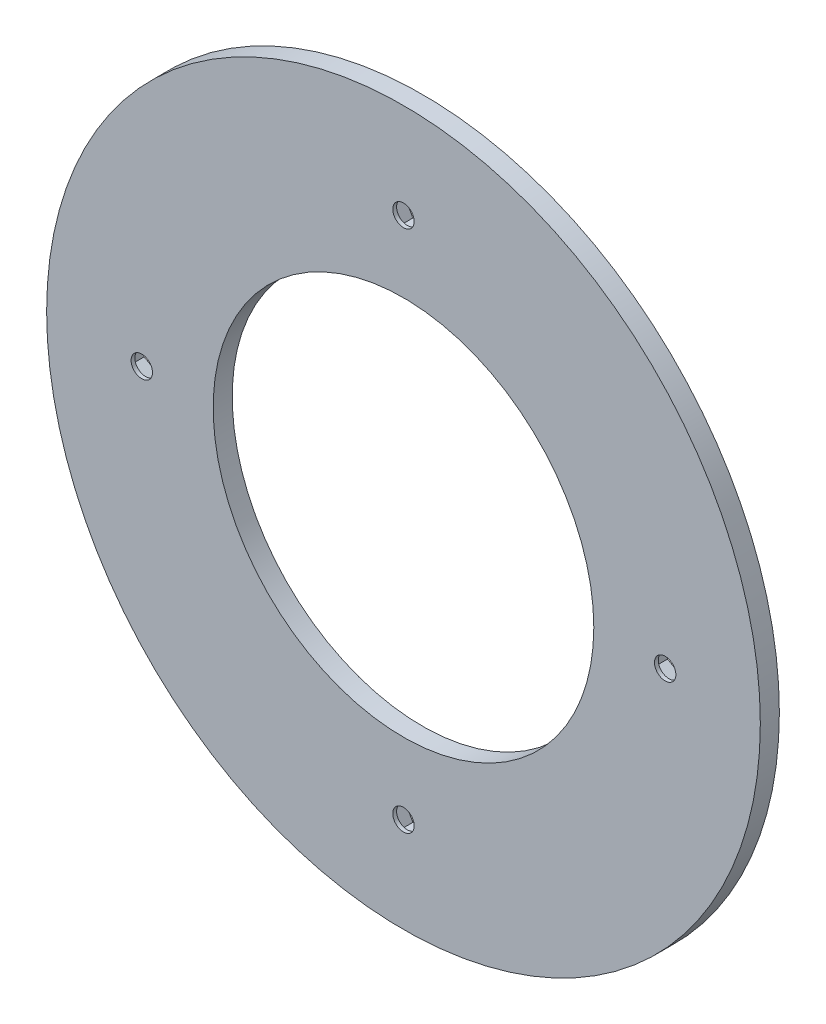
from build123d import *

# Parameters (mm, degrees)
SKETCH1_R            = 75
SKETCH1_R_2          = 40
BOSS_EXTRUDE1_DEPTH  = 4
M4_CLEARANCE_HOLE1_D = 4.5
CUT_EXTRUDE2_DEPTH   = 3.2


with BuildPart() as part:
    # Sketch1 → Boss-Extrude1 (new body)
    with BuildSketch(Plane.XY):
        Circle(SKETCH1_R)
        Circle(SKETCH1_R_2, mode=Mode.SUBTRACT)
    extrude(amount=BOSS_EXTRUDE1_DEPTH)

    # M4 Clearance Hole1 (through all)
    with Locations(Plane(origin=(0, 0, 0), x_dir=(-1, 0, 0), z_dir=(0, 0, -1))):
        with Locations((0, 55), (55, 0), (0, -55), (-55, 0)):
            Hole(M4_CLEARANCE_HOLE1_D / 2)

    # Sketch13 → Cut-Extrude2 (cut)
    with BuildSketch(Plane(origin=(0, 0, 0), x_dir=(-1, 0, 0), z_dir=(0, 0, -1))):
        Polygon((4.041451884, 55), (2.020725942, 58.5), (-2.020725942, 58.5), (-4.041451884, 55), (-2.020725942, 51.5), (2.020725942, 51.5), align=None)
        Polygon((55, -4.041451884), (58.5, -2.020725942), (58.5, 2.020725942), (55, 4.041451884), (51.5, 2.020725942), (51.5, -2.020725942), align=None)
        Polygon((-4.041451884, -55), (-2.020725942, -58.5), (2.020725942, -58.5), (4.041451884, -55), (2.020725942, -51.5), (-2.020725942, -51.5), align=None)
        Polygon((-55, 4.041451884), (-58.5, 2.020725942), (-58.5, -2.020725942), (-55, -4.041451884), (-51.5, -2.020725942), (-51.5, 2.020725942), align=None)
    extrude(amount=-CUT_EXTRUDE2_DEPTH, mode=Mode.SUBTRACT)


solid = part.part
